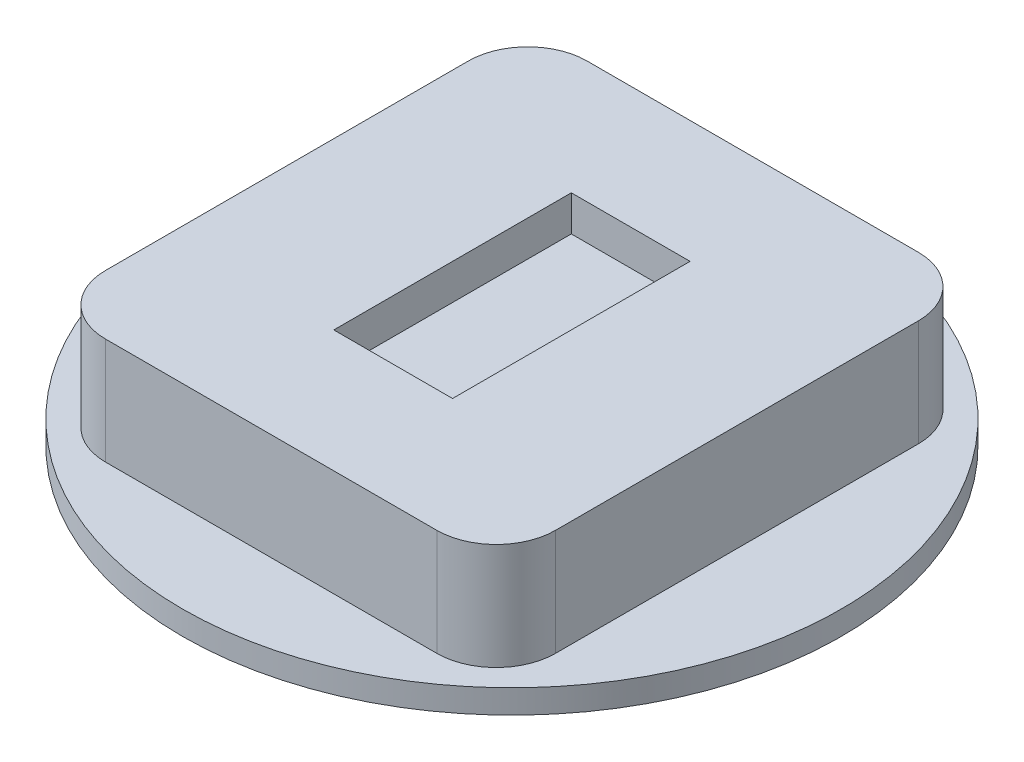
from build123d import *

# Parameters (mm, degrees)
BOSS_EXTRUDE1_DEPTH      = 10
BOSS_EXTRUDE1_DEPTH_BACK = 10
SKETCH1_R                = 277.5
SKETCH2_W                = 378.949229626
SKETCH2_H                = 405.490420806
BOSS_EXTRUDE2_DEPTH      = 89.720477931
SKETCH6_W                = 100
SKETCH6_H                = 200
CUT_EXTRUDE4_DEPTH       = 30
FILLET2_R                = 50


with BuildPart() as part:
    # Sketch1 → Boss-Extrude1 (new, two sides: drawn at the far end of the back side and taken through both)
    with BuildSketch(Plane(origin=(0, 0, 0), x_dir=(1, 0, 0), z_dir=(0, 1, 0)).offset(-BOSS_EXTRUDE1_DEPTH_BACK)):
        Circle(SKETCH1_R)
    extrude(amount=BOSS_EXTRUDE1_DEPTH + BOSS_EXTRUDE1_DEPTH_BACK)

    # Sketch2 → Boss-Extrude2 (add)
    with BuildSketch(Plane(origin=(0, 10, 0), x_dir=(1, 0, 0), z_dir=(0, 1, 0))):
        Rectangle(SKETCH2_W, SKETCH2_H)
    extrude(amount=BOSS_EXTRUDE2_DEPTH)

    # Sketch6 → Cut-Extrude4 (cut)
    with BuildSketch(Plane(origin=(0, 99.720477931, 0), x_dir=(1, 0, 0), z_dir=(0, 1, 0))):
        Rectangle(SKETCH6_W, SKETCH6_H)
    extrude(amount=-CUT_EXTRUDE4_DEPTH, mode=Mode.SUBTRACT)

    # Fillet2
    fillet2_edges = [part.edges().sort_by_distance(p)[0] for p in [
        (-189.474614813, 54.860238966, -202.745210403),
        (-189.474614813, 54.860238966, 202.745210403),
        (189.474614813, 54.860238966, -202.745210403),
        (189.474614813, 54.860238966, 202.745210403),
    ]]
    fillet(fillet2_edges, radius=FILLET2_R)


solid = part.part
